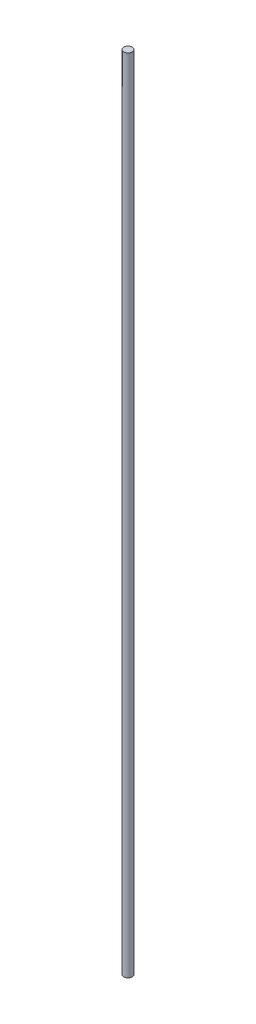
from build123d import *

# Parameters (mm, degrees)
SKETCH1_R           = 1.5875
BOSS_EXTRUDE1_DEPTH = 150


with BuildPart() as part:
    # Sketch1 → Boss-Extrude1 (new, symmetric)
    with BuildSketch(Plane(origin=(0, 0, 0), x_dir=(1, 0, 0), z_dir=(0, 1, 0))):
        Circle(SKETCH1_R)
    extrude(amount=BOSS_EXTRUDE1_DEPTH, both=True)


solid = part.part
